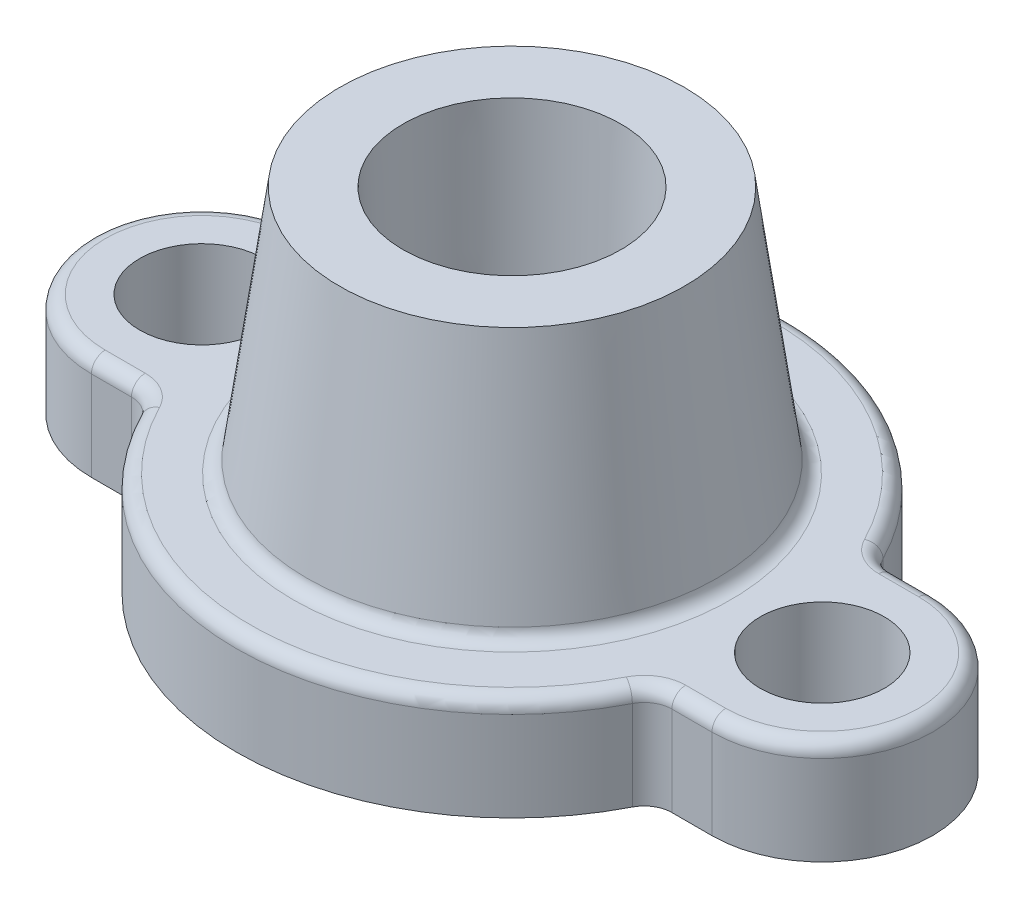
from build123d import *

# Parameters (mm, degrees)
EXTRUDE_1_OUTLINE_R = 4.5
EXTRUDE_1_DEPTH     = 7.5
FILLET_1_R          = 2
FILLET_2_R          = 1
CHAMFER_1_SIZE      = 3


# Read off the part's stored shape, not the designer's step: 伸長1
with BuildPart() as part:
    # 伸長1 outline → 伸長1 (new body)
    with BuildSketch(Plane(origin=(0, 0, 0), x_dir=(1, 0, 0), z_dir=(0, 1, 0))):
        with BuildLine():
            ThreePointArc((18.33030278, 8), (0, 20), (-18.33030278, 8))
            Line((-18.33030278, 8), (-22.5, 8))
            ThreePointArc((-22.5, 8), (-30.5, 0), (-22.5, -8))
            Line((-22.5, -8), (-18.33030278, -8))
            ThreePointArc((-18.33030278, -8), (0, -20), (18.33030278, -8))
            Line((18.33030278, -8), (22.5, -8))
            ThreePointArc((22.5, -8), (30.5, 0), (22.5, 8))
            Line((22.5, 8), (18.33030278, 8))
        make_face()
        with Locations((-22.5, 0)):
            Circle(EXTRUDE_1_OUTLINE_R, mode=Mode.SUBTRACT)
        with Locations((22.5, 0)):
            Circle(EXTRUDE_1_OUTLINE_R, mode=Mode.SUBTRACT)
    extrude(amount=EXTRUDE_1_DEPTH)

    # 圓角1
    fillet_1_edges = [part.edges().sort_by_distance(p)[0] for p in [
        (18.33030278, 3.75, -8),
        (18.33030278, 3.75, 8),
        (-18.33030278, 3.75, 8),
        (-18.33030278, 3.75, -8),
    ]]
    fillet(fillet_1_edges, radius=FILLET_1_R)

    # 草圖3 → 旋轉1 (revolve)
    with BuildSketch(Plane.XY, mode=Mode.PRIVATE) as revolve_1_sk:
        Polygon((0, 25.5), (12.5, 25.5), (15, 7.5), (0, 7.5), align=None)
    revolve(revolve_1_sk.sketch.rotate(Axis((0, 0, 0), (0, 1, 0)), 90), axis=Axis((0, 0, 0), (0, 1, 0)))

    # 圓角2
    fillet_2_edges = [part.edges().sort_by_distance(p)[0] for p in [
        (-30.5, 7.5, 0),
        (-21.047958971, 7.5, 8),
        (30.5, 7.5, 0),
        (21.047958971, 7.5, -8),
        (21.047958971, 7.5, 8),
        (0, 7.5, 20),
        (0, 7.5, -20),
        (-21.047958971, 7.5, -8),
        (18.551452007, 7.5, 8.294394269),
        (18.551452007, 7.5, -8.294394269),
        (-18.551452007, 7.5, -8.294394269),
        (-18.551452007, 7.5, 8.294394269),
        (0, 7.5, 15),
    ]]
    fillet(fillet_2_edges, radius=FILLET_2_R)

    # 草圖4 → 除料-旋轉1 (revolve, cut)
    with BuildSketch(Plane.XY, mode=Mode.PRIVATE) as cut_revolve_1_sk:
        Polygon((0, 0), (4.5, 0), (4.5, 7.5), (10.5, 7.5), (10.5, 10.5), (0, 10.5), align=None)
    revolve(cut_revolve_1_sk.sketch.rotate(Axis((0, 0, 0), (0, 1, 0)), 90), axis=Axis((0, 0, 0), (0, 1, 0)), mode=Mode.SUBTRACT)

    # 導角1
    chamfer_1_edges = [part.edges().sort_by_distance(p)[0] for p in [
        (0, 0, 4.5),
    ]]
    chamfer(chamfer_1_edges, length=CHAMFER_1_SIZE)

    # 草圖7 → 3/8 Rc 螺紋孔1 (revolve, cut)
    with BuildSketch(Plane(origin=(0, 25.5, 0), x_dir=(0, 0, 1), z_dir=(1, 0, 0))):
        Polygon((0, 0), (0, 22.386153426), (7.15, 18.09), (7.15, 11.4), (7.54713052, 11.4), (7.903, 0), align=None)
    revolve(axis=Axis((0, 31.85, 0), (0, -1, 0)), mode=Mode.SUBTRACT)


solid = part.part
